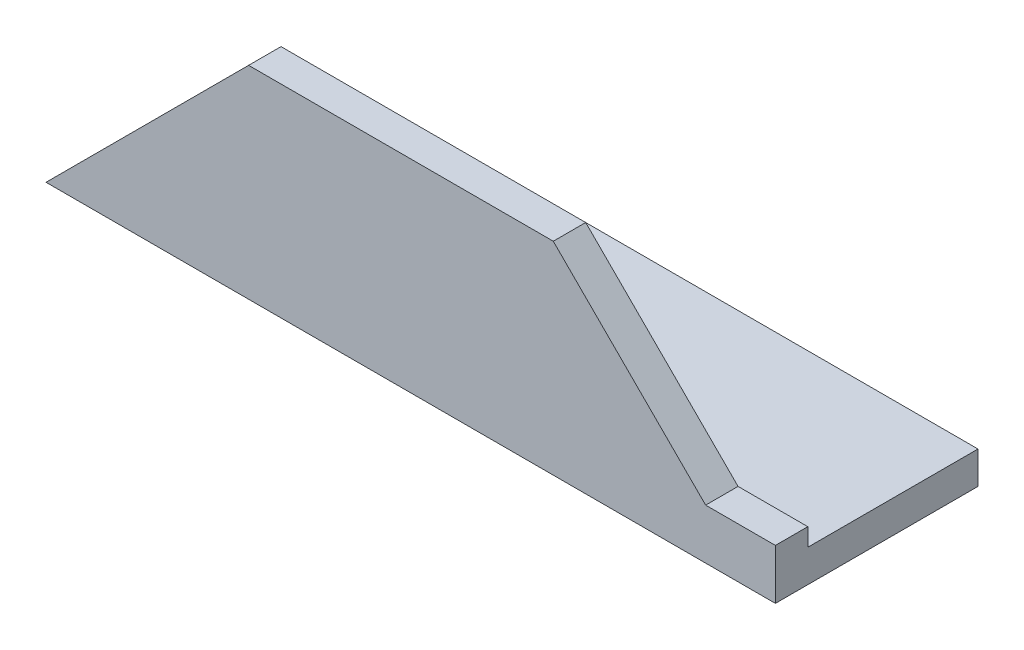
from build123d import *

# Parameters (mm, degrees)
EXTRUDE_1_DEPTH     = 90
CUT_EXTRUDE_1_DEPTH = 97.695398029


with BuildPart() as part:
    # Эскиз1 → Вытянуть-Тонкостенный1 (new body)
    with BuildSketch(Plane(origin=(0, 0, 0), x_dir=(0, 0, -1), z_dir=(1, 0, 0))):
        Polygon((0, 25), (0, 0), (25, 0), (25, 4), (4, 4), (4, 25), align=None)
    extrude(amount=EXTRUDE_1_DEPTH)

    # Эскиз2 → Вырез-Вытянуть1 (cut, through all)
    with BuildSketch(Plane.XY):
        Polygon((0, 0), (0, 25), (25, 25), align=None)
        Polygon((90, 6.199303699), (81.394610848, 6.199303699), (62.593914547, 25), (90, 25), align=None)
    extrude(amount=-CUT_EXTRUDE_1_DEPTH, mode=Mode.SUBTRACT)


solid = part.part
